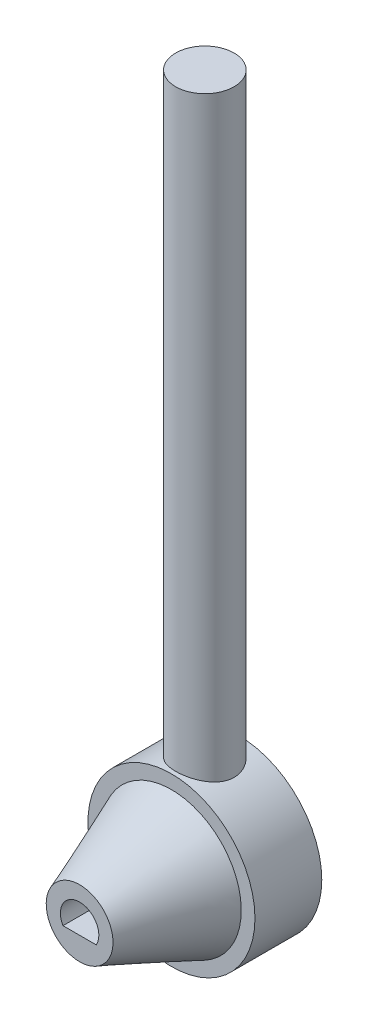
from build123d import *

# Parameters (mm, degrees)
SKETCH1_R           = 3.5
BOSS_EXTRUDE1_DEPTH = 90
SKETCH4_R           = 10
BOSS_EXTRUDE2_DEPTH = 4
BOSS_EXTRUDE3_START = -4
SKETCH4_7_R         = 10
BOSS_EXTRUDE3_DEPTH = 4
CUT_EXTRUDE3_DEPTH  = 6.5


with BuildPart() as part:
    # Sketch1 → Boss-Extrude1 (new body)
    with BuildSketch(Plane(origin=(0, 0, 0), x_dir=(1, 0, 0), z_dir=(0, 1, 0))):
        with Locations(Location((0, 0, 0), (0, 0, 90))):
            Circle(SKETCH1_R)
    extrude(amount=BOSS_EXTRUDE1_DEPTH)

    # Sketch4 → Boss-Extrude2 (add)
    with BuildSketch(Plane.XY):
        with Locations(Location((0, 9, 0), (0, 0, 110.487315115))):
            Circle(SKETCH4_R)
    extrude(amount=BOSS_EXTRUDE2_DEPTH)

    # Sketch4<7> → Boss-Extrude3 (add)
    with BuildSketch(Plane.XY.offset(BOSS_EXTRUDE3_START)):
        with Locations((0, 9)):
            Circle(SKETCH4_7_R)
    extrude(amount=BOSS_EXTRUDE3_DEPTH)

    # Loft2: read off the stored shape, not the designer's step
    # Loft2: loft between two sections, ruled curve by curve
    loft2_from = [
        Edge.make_bspline([(-9.973450677, 9.728204366, 0), (-11.429859409, -10.218696987, 0), (8.517041945, -11.67510572, 0), (9.973450677, 8.271795634, 0), (11.429859409, 28.218696987, 0), (-8.517041945, 29.67510572, 0), (-9.973450677, 9.728204366, 0)], [0, 0, 0, 0, 0.5, 0.5, 0.5, 1, 1, 1, 1], 3, [1, 0.333333333, 0.333333333, 1, 0.333333333, 0.333333333, 1]),
    ]
    loft2_to = [
        Edge.make_bspline([(-3.898107491, 8.102916956, 15), (-2.103941404, 0.306701974, 15), (5.692273579, 2.100868062, 15), (3.898107491, 9.897083044, 15), (2.103941404, 17.693298026, 15), (-5.692273579, 15.899131938, 15), (-3.898107491, 8.102916956, 15)], [0, 0, 0, 0, 0.5, 0.5, 0.5, 1, 1, 1, 1], 3, [1, 0.333333333, 0.333333333, 1, 0.333333333, 0.333333333, 1]),
    ]
    loft2 = Solid(Shell([*[Face.make_surface_from_curves(loft2_from[k], loft2_to[k]) for k in range(1)], Face(Wire(loft2_from)), Face(Wire(loft2_to))]))
    add(loft2)

    # Sketch5 → Cut-Extrude3 (cut)
    with BuildSketch(Plane.XY.offset(15)):
        with BuildLine():
            Line((1.99219482, 7.750633525), (-1.99219482, 7.750633525))
            ThreePointArc((-1.99219482, 7.750633525), (0, 11.200050682), (1.99219482, 7.750633525))
        make_face()
    extrude(amount=-CUT_EXTRUDE3_DEPTH, mode=Mode.SUBTRACT)


solid = part.part
